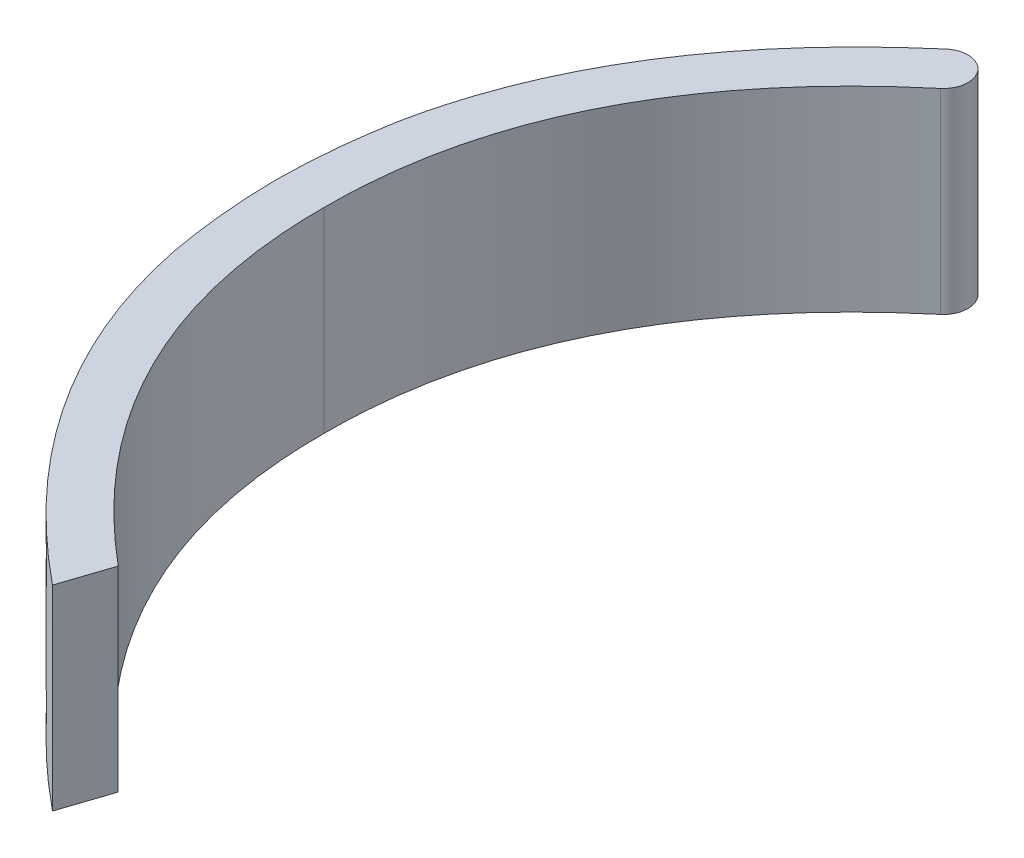
from build123d import *

# Parameters (mm, degrees)
EXTRUDE_1_DEPTH = 8
FILLET_2_R      = 1


with BuildPart() as part:
    # 草图1 → 凸台-拉伸1 (new body)
    with BuildSketch(Plane(origin=(0, 0, 0), x_dir=(1, 0, 0), z_dir=(0, 1, 0))):
        with BuildLine():
            add(Edge.make_bspline(
                [(0, 17.5), (-3.018559866, 15.126656034), (-5.050027734, 12.449972293)],
                knots=[0, 0, 0, 0.266241411, 0.266241411, 0.266241411], degree=2))
            ThreePointArc((0, 17.5), (-1.715353459, 17.415727447), (-3.414186094, 17.16372143))
            add(Edge.make_bspline(
                [(-3.414186094, 17.16372143), (-8.043161647, 12.78312826), (-9.916919162, 7.583080838)],
                knots=[0.089180087, 0.089180087, 0.089180087, 0.527021845, 0.527021845, 0.527021845], degree=2))
            add(Edge.make_bspline(
                [(-9.916919162, 7.583080838), (-10.441389168, 6.127572919), (-10.75, 4.607864376)],
                knots=[0.527021845, 0.527021845, 0.527021845, 0.649574986, 0.649574986, 0.649574986], degree=2))
            add(Edge.make_bspline(
                [(-11.190859313, 0), (-11.178661457, 2.24200009), (-10.75, 4.607864376)],
                knots=[0.829773285, 0.829773285, 0.829773285, 1, 1, 1], degree=2))
            add(Edge.make_bspline(
                [(-11.190859313, 0), (-11.178661457, -2.24200009), (-10.75, -4.607864376)],
                knots=[0.829773285, 0.829773285, 0.829773285, 1, 1, 1], degree=2))
            add(Edge.make_bspline(
                [(-3.414186094, -17.16372143), (-9.338824941, -11.556987894), (-10.75, -4.607864376)],
                knots=[0.089180087, 0.089180087, 0.089180087, 0.649574986, 0.649574986, 0.649574986], degree=2))
            ThreePointArc((-3.414186094, -17.16372143), (-2.179900554, -17.36369873), (-0.934486298, -17.47503177))
            Line((-0.934486298, -17.47503177), (-0.742530402, -16.899164082))
            add(Edge.make_bspline(
                [(-0.742530402, -16.899164082), (-3.273656048, -14.790538581), (-5.050027734, -12.449972293)],
                knots=[0.033432558, 0.033432558, 0.033432558, 0.266241411, 0.266241411, 0.266241411], degree=2))
            add(Edge.make_bspline(
                [(-5.050027734, -12.449972293), (-7.812978864, -8.809478401), (-8.75, -4.607864376)],
                knots=[0.266241411, 0.266241411, 0.266241411, 0.628350021, 0.628350021, 0.628350021], degree=2))
            add(Edge.make_bspline(
                [(-8.75, -4.607864376), (-9.246260347, -2.382627023), (-9.23036206, 0)],
                knots=[0.628350021, 0.628350021, 0.628350021, 0.820128134, 0.820128134, 0.820128134], degree=2))
            add(Edge.make_bspline(
                [(-8.75, 4.607864376), (-9.246260347, 2.382627023), (-9.23036206, 0)],
                knots=[0.628350021, 0.628350021, 0.628350021, 0.820128134, 0.820128134, 0.820128134], degree=2))
            add(Edge.make_bspline(
                [(-5.050027734, 12.449972293), (-7.812978864, 8.809478401), (-8.75, 4.607864376)],
                knots=[0.266241411, 0.266241411, 0.266241411, 0.628350021, 0.628350021, 0.628350021], degree=2))
        make_face()
        with BuildLine():
            ThreePointArc((-3.414186094, 17.16372143), (-1.715353459, 17.415727447), (0, 17.5))
            Line((0, 17.5), (-1.414213562, 18.914213562))
            add(Edge.make_bspline(
                [(-1.414213562, 18.914213562), (-2.471351299, 18.05596543), (-3.414186094, 17.16372143)],
                knots=[0, 0, 0, 0.089180087, 0.089180087, 0.089180087], degree=2))
        make_face()
        with BuildLine():
            add(Edge.make_bspline(
                [(-1.414213562, -18.914213562), (-2.471351299, -18.05596543), (-3.414186094, -17.16372143)],
                knots=[0, 0, 0, 0.089180087, 0.089180087, 0.089180087], degree=2))
            Line((-1.414213562, -18.914213562), (-0.934486298, -17.47503177))
            ThreePointArc((-0.934486298, -17.47503177), (-2.179900554, -17.36369873), (-3.414186094, -17.16372143))
        make_face()
    extrude(amount=EXTRUDE_1_DEPTH)

    # 圆角2
    # the kernel refuses this fillet: 1 mm, written as the material it takes off along each edge
    with BuildSketch(Plane(origin=(-1.414213562, 0, -18.914213562), x_dir=(0.7071067811865474, 0, 0.7071067811865478), z_dir=(0, 1, 0))) as fillet_2_piece_1:
        with BuildLine():
            CenterArc((0.912847355, -1), FILLET_2_R, 90, 85.515704576)
            Line((-0.084091447, -0.921814159), (-0.104030223, -0.920250442))
            ThreePointArc((-0.104030223, -0.920250442), (-0.06486668, -0.458824048), (-0.019893041, 0.002065651))
            Line((-0.019893041, 0.002065651), (0, 0.02))
            Line((0, 0.02), (0.912847355, 0.02))
            Line((0.912847355, 0.02), (0.912847355, 0))
        make_face()
    extrude(amount=8, mode=Mode.SUBTRACT)
    with BuildSketch(Plane(origin=(0, 0, -17.5), x_dir=(-0.7760833502518973, 0, 0.6306303461313852), z_dir=(0, 1, 0))) as fillet_2_piece_2:
        with BuildLine():
            CenterArc((1.108716697, -0.99986523), FILLET_2_R, 90.940675656, 94.962680688)
            Line((0.114019904, -1.102716035), (0.094125968, -1.104773051))
            Line((0.094125968, -1.104773051), (-0.019893936, -0.002057016))
            Line((-0.019893936, -0.002057016), (0.000321277, 0.019997419))
            ThreePointArc((0.000321277, 0.019997419), (0.546151149, 0.015565202), (1.091971205, 0.019997305))
            Line((1.091971205, 0.019997305), (1.092299548, 0))
        make_face()
    extrude(amount=8, mode=Mode.SUBTRACT)


solid = part.part
